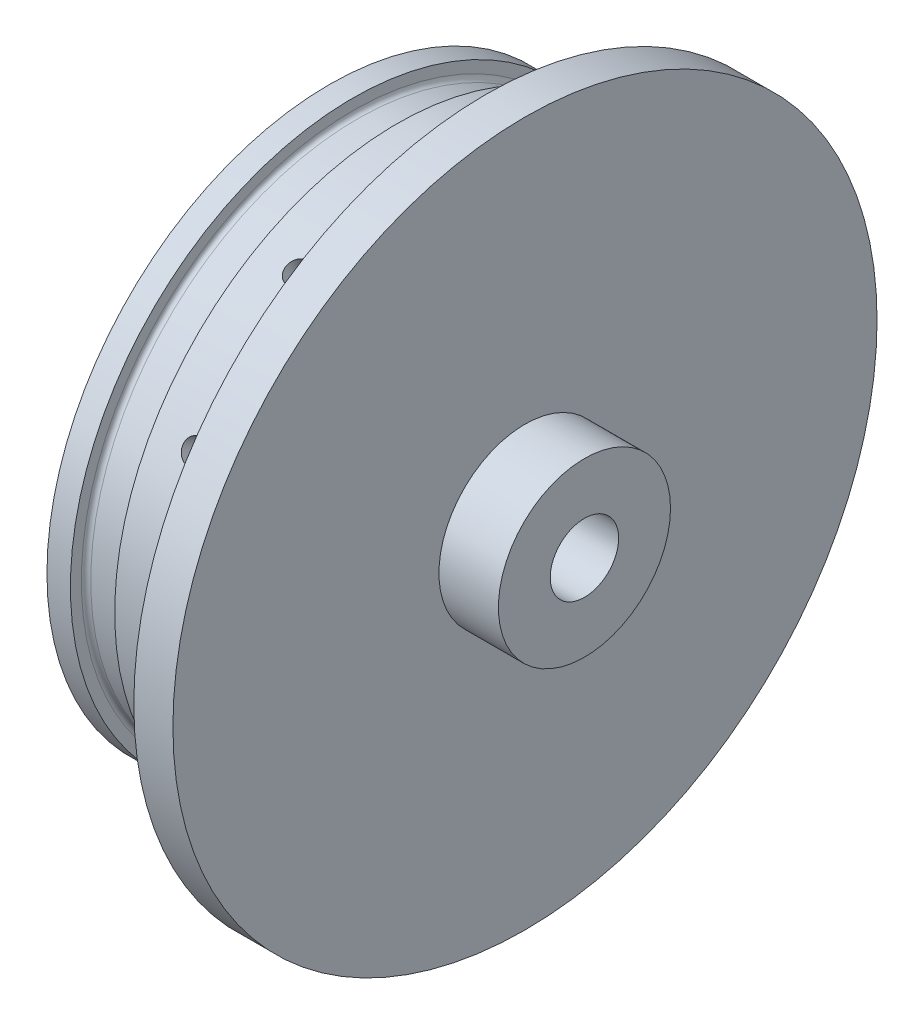
from build123d import *

# Parameters (mm, degrees)
SKETCH1_R               = 57.15
BOSS_EXTRUDE1_DEPTH     = 6.35
SKETCH2_R               = 45.847
BOSS_EXTRUDE2_DEPTH     = 25.4
SKETCH11_R              = 1.89865
CUT_EXTRUDE3_DEPTH      = 10.16
CIRPATTERN1_COUNT       = 12
CUT_EXTRUDE4_DEPTH      = 87.83494404
CUT_EXTRUDE4_DEPTH_BACK = 87.83494404
SKETCH15_R              = 5.55625
BOSS_EXTRUDE3_START     = 9.652
SKETCH17_R              = 13.97
SKETCH17_R_2            = 5.55625
BOSS_EXTRUDE3_DEPTH     = 9.652
SKETCH18_R              = 38.354
CUT_EXTRUDE5_DEPTH      = 6.604
SKETCH19_R              = 1.1303
CUT_EXTRUDE6_DEPTH      = 6.35


with BuildPart() as part:
    # Sketch1 → Boss-Extrude1 (new body)
    with BuildSketch(Plane(origin=(0, 0, 0), x_dir=(0, 0, -1), z_dir=(1, 0, 0))):
        Circle(SKETCH1_R)
    extrude(amount=BOSS_EXTRUDE1_DEPTH)

    # Sketch2 → Boss-Extrude2 (add)
    with BuildSketch(Plane.ZY):
        Circle(SKETCH2_R)
    extrude(amount=BOSS_EXTRUDE2_DEPTH)

    # Sketch11 → Cut-Extrude3 (cut)
    with BuildSketch(Plane(origin=(0, 0, -45.847), x_dir=(-1, 0, 0), z_dir=(0, 0, -1))):
        with Locations((7.62, 0)):
            Circle(SKETCH11_R)
    cut_extrude3 = extrude(amount=-CUT_EXTRUDE3_DEPTH, mode=Mode.SUBTRACT)

    # CirPattern1: Cut-Extrude3 ×12 about axis
    cirpattern1_axis = Axis((0, 0, 0), (-1, 0, 0))
    for i in range(1, CIRPATTERN1_COUNT):
        add(cut_extrude3.rotate(cirpattern1_axis, i * 360 / CIRPATTERN1_COUNT), mode=Mode.SUBTRACT)

    # Sketch15 → Cut-Extrude4 (cut, two sides: drawn at the far end of the back side and taken through both)
    with BuildSketch(Plane(origin=(6.35, 0, 0), x_dir=(0, 0, -1), z_dir=(1, 0, 0)).offset(-CUT_EXTRUDE4_DEPTH_BACK)):
        Circle(SKETCH15_R)
    extrude(amount=CUT_EXTRUDE4_DEPTH + CUT_EXTRUDE4_DEPTH_BACK, mode=Mode.SUBTRACT)

    # Sketch16 → Cut-Revolve1 (revolve, cut)
    with BuildSketch(Plane.XY):
        with BuildLine():
            Line((-21.59, 45.847), (-14.4018, 45.847))
            Line((-14.4018, 45.847), (-14.4018, 44.069))
            ThreePointArc((-14.4018, 44.069), (-14.624984633, 43.530184633), (-15.1638, 43.307))
            Line((-15.1638, 43.307), (-20.828, 43.307))
            ThreePointArc((-20.828, 43.307), (-21.366815367, 43.530184633), (-21.59, 44.069))
            Line((-21.59, 44.069), (-21.59, 45.847))
        make_face()
    revolve(axis=Axis((0, 0, 0), (-1, 0, 0)), mode=Mode.SUBTRACT)

    # Sketch17 → Boss-Extrude3 (add)
    with BuildSketch(Plane(origin=(6.35, 0, 0), x_dir=(0, 0, -1), z_dir=(1, 0, 0)).offset(BOSS_EXTRUDE3_START)):
        Circle(SKETCH17_R)
        Circle(SKETCH17_R_2, mode=Mode.SUBTRACT)
    extrude(amount=-BOSS_EXTRUDE3_DEPTH)

    # Sketch18 → Cut-Extrude5 (cut)
    with BuildSketch(Plane.ZY.offset(25.4)):
        Circle(SKETCH18_R)
    extrude(amount=-CUT_EXTRUDE5_DEPTH, mode=Mode.SUBTRACT)

    # Sketch19 → Cut-Extrude6 (cut)
    with BuildSketch(Plane.ZY.offset(18.796)):
        with Locations((0, 33.3375)):
            Circle(SKETCH19_R)
        with Locations((23.573172318, 23.573172318)):
            Circle(SKETCH19_R)
        with Locations((33.3375, 0)):
            Circle(SKETCH19_R)
        with Locations((23.573172318, -23.573172318)):
            Circle(SKETCH19_R)
        with Locations((0, -33.3375)):
            Circle(SKETCH19_R)
        with Locations((-23.573172318, -23.573172318)):
            Circle(SKETCH19_R)
        with Locations((-33.3375, 0)):
            Circle(SKETCH19_R)
        with Locations((-23.573172318, 23.573172318)):
            Circle(SKETCH19_R)
    extrude(amount=-CUT_EXTRUDE6_DEPTH, mode=Mode.SUBTRACT)

    # Sketch20 → Cut-Revolve2 (revolve, cut)
    with BuildSketch(Plane.XY):
        Polygon((0, 0), (-18.796, 0), (-18.796, 25.4), (0, 12.7), align=None)
    revolve(axis=Axis((0, 0, 0), (-1, 0, 0)), mode=Mode.SUBTRACT)


solid = part.part
